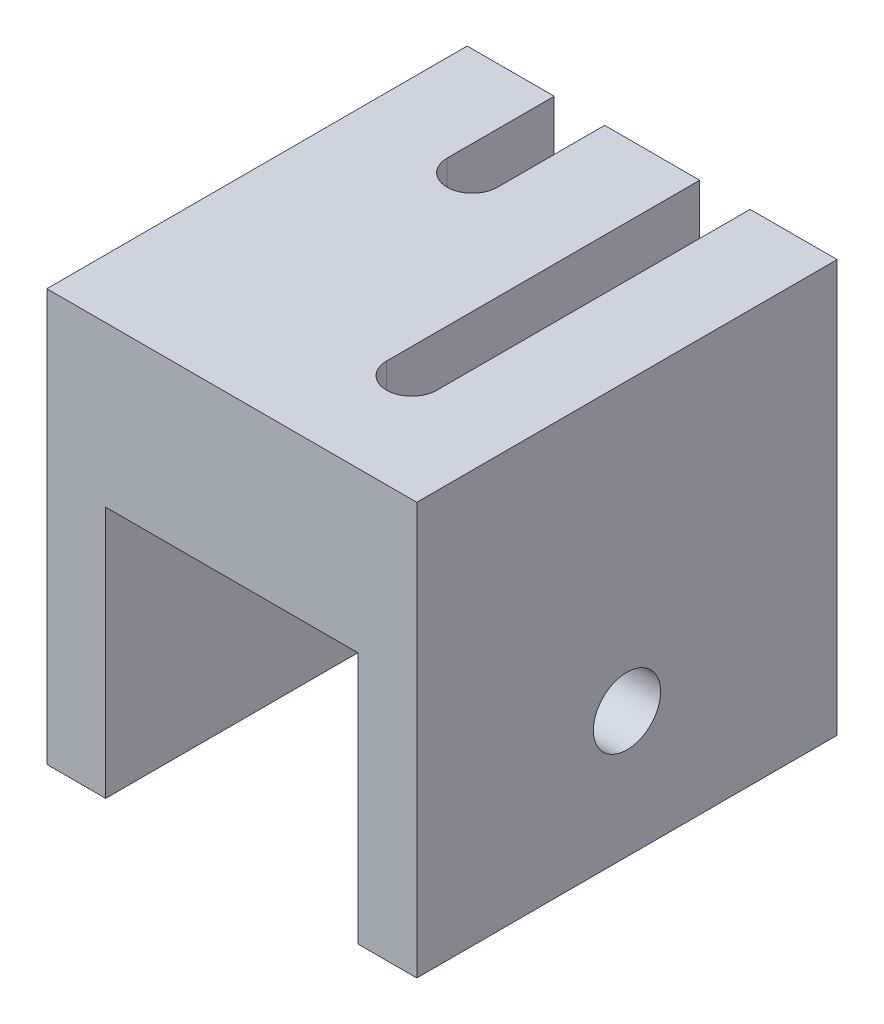
from build123d import *

# Parameters (mm, degrees)
BOSS_EXTRUDE1_DEPTH = 50
BOSS_EXTRUDE2_DEPTH = 6
BOSS_EXTRUDE4_DEPTH = 6
CUT_EXTRUDE1_DEPTH  = 59


with BuildPart() as part:
    # Sketch1 → Boss-Extrude1 (new body)
    with BuildSketch(Plane.XY):
        Polygon((-22, 22), (-22, -15), (-15, -15), (-15, 15), (15, 15), (15, -15), (22, -15), (22, 22), align=None)
    extrude(amount=BOSS_EXTRUDE1_DEPTH)

    # Sketch3 → Boss-Extrude2 (add)
    with BuildSketch(Plane(origin=(0, 22, 0), x_dir=(1, 0, 0), z_dir=(0, 1, 0))):
        with BuildLine():
            ThreePointArc((-3.650247964, -12.745482051), (-8.650247964, -17.745482051), (-13.650247964, -12.745482051))
            Line((-13.650247964, -12.745482051), (-13.650247964, 0))
            Line((-13.650247964, 0), (-22, 0))
            Line((-22, 0), (-22, -50))
            Line((-22, -50), (22, -50))
            Line((22, -50), (22, 0))
            Line((22, 0), (13.650247964, 0))
            Line((13.650247964, 0), (13.650247964, -37.254517949))
            ThreePointArc((13.650247964, -37.254517949), (8.650247964, -42.254517949), (3.650247964, -37.254517949))
            Line((3.650247964, -37.254517949), (3.650247964, 0))
            Line((3.650247964, 0), (-3.650247964, 0))
            Line((-3.650247964, 0), (-3.650247964, -12.745482051))
        make_face()
    extrude(amount=BOSS_EXTRUDE2_DEPTH)

    # Sketch4 → Boss-Extrude4 (add)
    with BuildSketch(Plane(origin=(0, 28, 0), x_dir=(1, 0, 0), z_dir=(0, 1, 0))):
        with BuildLine():
            ThreePointArc((11.650247964, -37.254517949), (8.650247964, -40.254517949), (5.650247964, -37.254517949))
            Line((5.650247964, -37.254517949), (5.650247964, 0))
            Line((5.650247964, 0), (-5.650247964, 0))
            Line((-5.650247964, 0), (-5.650247964, -12.745482051))
            ThreePointArc((-5.650247964, -12.745482051), (-8.650247964, -15.745482051), (-11.650247964, -12.745482051))
            Line((-11.650247964, -12.745482051), (-11.650247964, 0))
            Line((-11.650247964, 0), (-22, 0))
            Line((-22, 0), (-22, -50))
            Line((-22, -50), (22, -50))
            Line((22, -50), (22, 0))
            Line((22, 0), (11.650247964, 0))
            Line((11.650247964, 0), (11.650247964, -37.254517949))
        make_face()
    extrude(amount=BOSS_EXTRUDE4_DEPTH)

    # Sketch5 → Cut-Extrude1 (cut)
    with BuildSketch(Plane.ZY.offset(22)):
        with BuildLine():
            ThreePointArc((25, -4), (27.828427125, -2.828427125), (29, 0))
            ThreePointArc((29, 0), (27.828427125, 2.828427125), (25, 4))
            ThreePointArc((25, 4), (21, 0), (25, -4))
        make_face()
    extrude(amount=-CUT_EXTRUDE1_DEPTH, mode=Mode.SUBTRACT)


solid = part.part
